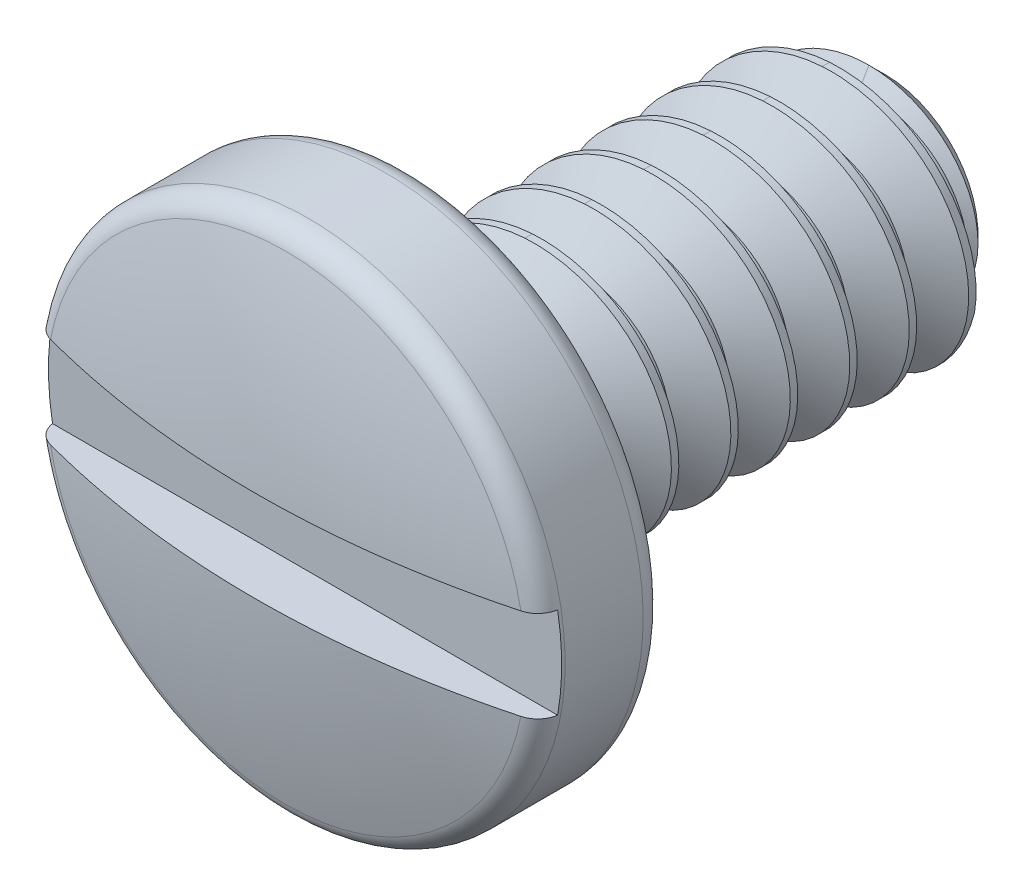
from build123d import *

# Parameters (mm, degrees)
SKETCH3_W               = 6.35
SKETCH3_H               = 1.237044252
SWEEP1_PITCH            = 0.79375
SWEEP2_PITCH            = 0.79375
SKETCH10_W              = 254
SKETCH10_H              = 12.7
SKETCH8_W               = 2.0828
SKETCH8_H               = 3.429
SKETCH12_W              = 6.858
SKETCH12_H              = 1.2192
CUT_EXTRUDE_THIN2_DEPTH = 0.6858


with BuildPart() as part:
    # Sketch3 → Revolve1 (revolve)
    with BuildSketch(Plane(origin=(0, 0, 0), x_dir=(0, 0, -1), z_dir=(1, 0, 0)), mode=Mode.PRIVATE) as revolve1_sk:
        with Locations((-3.175, 0.618522126)):
            Rectangle(SKETCH3_W, SKETCH3_H)
    revolve(revolve1_sk.sketch.rotate(Axis((0, 0, 0), (0, 0, -1)), 90), axis=Axis((0, 0, 0), (0, 0, -1)))

    # Sweep1: the profile of Sketch2 profile screwed along a right-hand helix of 9 turns, 6 arcs to a turn; built about Z, then put on its axis
    sweep1_z = Axis((0, 0, 0), (0, 0, 1))
    sweep1_corners = [(1.7526, 0, 0.049609375), (1.7526, 0, -0.049609375), (1.236744252, 0, -0.34743883), (1.236744252, 0, 0.34743883)]
    with BuildLine(mode=Mode.PRIVATE) as sweep1_profile:
        Line(sweep1_corners[0], sweep1_corners[1])
        Line(sweep1_corners[1], sweep1_corners[2])
        Line(sweep1_corners[2], sweep1_corners[3])
        Line(sweep1_corners[3], sweep1_corners[0])
    sweep1_cap = Face(sweep1_profile.wire())
    sweep1_turn_angles = [0, 30, 60, 90, 120, 150, 180, 210, 240, 270, 300, 330, 360]
    sweep1_turn_weights = [1, 0.8660254037844387, 1, 0.8660254037844387, 1, 0.8660254037844387, 1, 0.8660254037844387, 1, 0.8660254037844387, 1, 0.8660254037844387, 1]
    sweep1_turn_rails = [Edge.make_bspline([Vector(p[0], p[1], 0).rotate(sweep1_z, sweep1_turn_angles[k]) / sweep1_turn_weights[k] + Vector(0, 0, p[2] + SWEEP1_PITCH * sweep1_turn_angles[k] / 360) for k in range(13)], [0, 0, 0, 1, 1, 2, 2, 3, 3, 4, 4, 5, 5, 6, 6, 6], 2, sweep1_turn_weights) for p in sweep1_corners]
    sweep1_turn_sides = [Face.make_surface_from_curves(sweep1_turn_rails[p[0]], sweep1_turn_rails[p[1]]) for p in [(0, 1), (1, 2), (2, 3), (3, 0)]]
    sweep1 = Plane(origin=(0, 0, 0), x_dir=(0, 1, 0), z_dir=(0, 0, 1)) * Solid(Shell([*[p.moved(Location((0, 0, SWEEP1_PITCH * i))) for i in range(9) for p in sweep1_turn_sides], sweep1_cap, sweep1_cap.rotate(sweep1_z, 3240).moved(Location((0, 0, SWEEP1_PITCH * 3240 / 360)))]))
    add(sweep1)

    # Sweep2: the profile of Sketch6 screwed along a right-hand helix of 1 turns, 6 arcs to a turn; built about Z, then put on its axis
    sweep2_z = Axis((0, 0, 0), (0, 0, 1))
    sweep2_corners = [(1.7526, 0, -0.049609375), (1.237044252, 0, -0.347265625), (1.237044252, 0, 0), (1.237044252, 0, 0.347265625), (1.7526, 0, 0.049609375)]
    with BuildLine(mode=Mode.PRIVATE) as sweep2_profile:
        Line(sweep2_corners[0], sweep2_corners[1])
        Line(sweep2_corners[1], sweep2_corners[2])
        Line(sweep2_corners[2], sweep2_corners[3])
        Line(sweep2_corners[3], sweep2_corners[4])
        Line(sweep2_corners[4], sweep2_corners[0])
    sweep2_cap = Face(sweep2_profile.wire())
    sweep2_turn_angles = [0, 30, 60, 90, 120, 150, 180, 210, 240, 270, 300, 330, 360]
    sweep2_turn_weights = [1, 0.8660254037844387, 1, 0.8660254037844387, 1, 0.8660254037844387, 1, 0.8660254037844387, 1, 0.8660254037844387, 1, 0.8660254037844387, 1]
    sweep2_turn_rails = [Edge.make_bspline([Vector(p[0], p[1], 0).rotate(sweep2_z, sweep2_turn_angles[k]) / sweep2_turn_weights[k] + Vector(0, 0, p[2] + SWEEP2_PITCH * sweep2_turn_angles[k] / 360) for k in range(13)], [0, 0, 0, 1, 1, 2, 2, 3, 3, 4, 4, 5, 5, 6, 6, 6], 2, sweep2_turn_weights) for p in sweep2_corners]
    sweep2_turn_sides = [Face.make_surface_from_curves(sweep2_turn_rails[p[0]], sweep2_turn_rails[p[1]]) for p in [(0, 1), (1, 2), (2, 3), (3, 4), (4, 0)]]
    sweep2 = Plane(origin=(0, 0, 0), x_dir=(0, 1, 0), z_dir=(0, 0, -1)) * Solid(Shell([*sweep2_turn_sides, sweep2_cap, sweep2_cap.rotate(sweep2_z, 360).moved(Location((0, 0, SWEEP2_PITCH * 360 / 360)))]))
    add(sweep2)

    # Sketch4 → Cut-Revolve1 (revolve, cut)
    with BuildSketch(Plane(origin=(0, 0, 0), x_dir=(0, 0, -1), z_dir=(1, 0, 0))):
        Polygon((0, 1.237044252), (-3.175, 4.412044252), (2.54, 4.412044252), (2.54, 0), (0, 0), align=None)
    revolve(axis=Axis((0, 0, -2.54), (0, 0, -1)), mode=Mode.SUBTRACT)

    # Sketch10 → Cut-Revolve2 (revolve, cut)
    with BuildSketch(Plane(origin=(0, 0, 0), x_dir=(0, 0, -1), z_dir=(1, 0, 0))):
        with Locations((-133.35, 6.35)):
            Rectangle(SKETCH10_W, SKETCH10_H)
    revolve(axis=Axis((0, 0, 0), (0, 0, -1)), mode=Mode.SUBTRACT)

    # Sketch8 → Revolve2 (revolve)
    with BuildSketch(Plane(origin=(0, 0, 0), x_dir=(0, 0, -1), z_dir=(1, 0, 0)), mode=Mode.PRIVATE) as revolve2_sk:
        with Locations((-7.3914, 1.7145)):
            Rectangle(SKETCH8_W, SKETCH8_H)
    revolve(revolve2_sk.sketch.rotate(Axis((0, 0, 0), (0, 0, 1)), 90), axis=Axis((0, 0, 0), (0, 0, 1)))

    # Sketch11 → Cut-Revolve3 (revolve, cut)
    with BuildSketch(Plane(origin=(0, 0, 0), x_dir=(0, 0, -1), z_dir=(1, 0, 0)), mode=Mode.PRIVATE) as cut_revolve3_sk:
        with BuildLine():
            Line((-7.70382, 3.429), (-6.66242, 3.429))
            ThreePointArc((-6.66242, 3.429), (-6.441505699, 3.337494301), (-6.35, 3.11658))
            Line((-6.35, 3.11658), (-5.715, 3.11658))
            Line((-5.715, 3.11658), (-5.715, 4.064))
            Line((-5.715, 4.064), (-9.0678, 4.064))
            Line((-9.0678, 4.064), (-9.0678, 0))
            Line((-9.0678, 0), (-8.4328, 0))
            ThreePointArc((-8.4328, 0), (-8.325445178, 1.61353744), (-8.005273266, 3.198629891))
            ThreePointArc((-8.005273266, 3.198629891), (-7.893520065, 3.364814046), (-7.70382, 3.429))
        make_face()
    revolve(cut_revolve3_sk.sketch.rotate(Axis((0, 0, 8.4328), (0, 0, -1)), 180), axis=Axis((0, 0, 8.4328), (0, 0, -1)), mode=Mode.SUBTRACT)

    # Sketch12 → Cut-Extrude-Thin2 (cut)
    with BuildSketch(Plane.XY.offset(8.4328)):
        Rectangle(SKETCH12_W, SKETCH12_H)
    extrude(amount=-CUT_EXTRUDE_THIN2_DEPTH, mode=Mode.SUBTRACT)


solid = part.part
